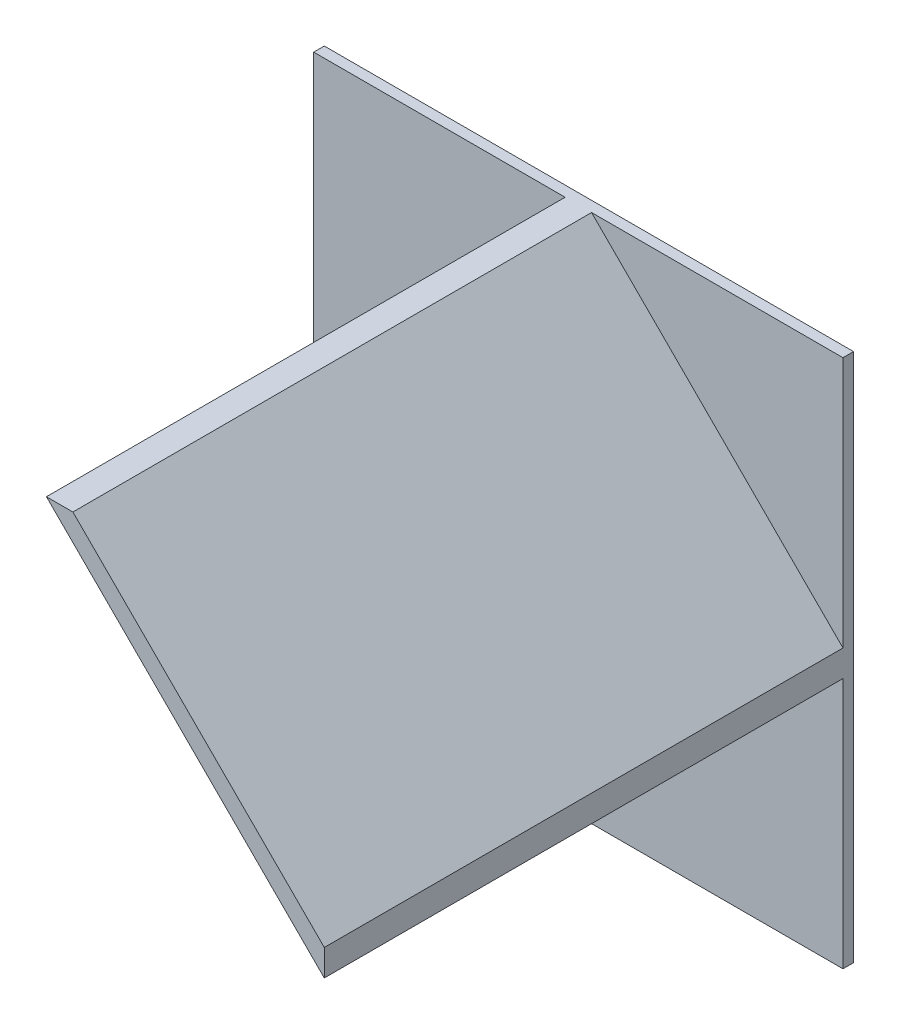
from build123d import *

# Parameters (mm, degrees)
SZKIC1_W                    = 200
SZKIC1_H                    = 200
DODANIE_WYCI_GNI_CIE1_DEPTH = 4
DODANIE_WYCI_GNI_CIE4_DEPTH = 196


with BuildPart() as part:
    # Szkic1 → Dodanie-wyciągnięcie1 (new body)
    with BuildSketch(Plane.XY):
        Rectangle(SZKIC1_W, SZKIC1_H)
    extrude(amount=DODANIE_WYCI_GNI_CIE1_DEPTH)

    # Szkic2 → Dodanie-wyciągnięcie4 (add)
    with BuildSketch(Plane.XY.offset(4)):
        Polygon((0, 100), (5, 100), (100, 5), (100, 0), (100, -5), (-5, 100), align=None)
    extrude(amount=DODANIE_WYCI_GNI_CIE4_DEPTH)


solid = part.part
